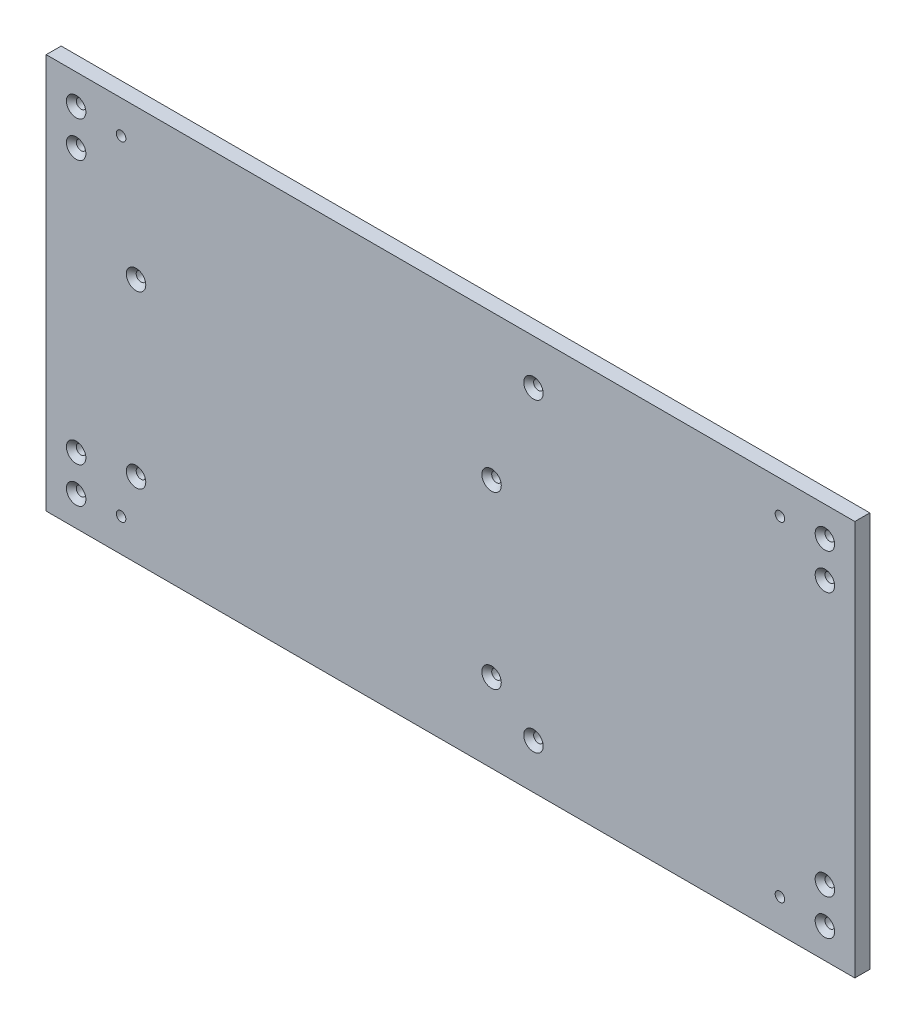
from build123d import *

# Parameters (mm, degrees)
SKETCH1_W                            = 270
SKETCH1_H                            = 132
SHEET_DEPTH                          = 2.5
F_3_2_3_2_WALLMOUNTHOLES_D           = 3.2
F_3_2_3_2_WALLMOUNTHOLES_CSINK_D     = 6.5
F_3_2_3_2_WALLMOUNTHOLES_CSINK_ANGLE = 90
F_3_2_3_2_FEETMOUNTHOLES_D           = 3.2
F_3_2_3_2_PSUHOLES_D                 = 3.2
F_3_2_3_2_PSUHOLES_CSINK_D           = 6.5
F_3_2_3_2_PSUHOLES_CSINK_ANGLE       = 90


with BuildPart() as part:
    # Sketch1 → Sheet (new, symmetric)
    with BuildSketch(Plane.XY):
        Rectangle(SKETCH1_W, SKETCH1_H)
    extrude(amount=SHEET_DEPTH, both=True)

    # Ø3.2 (3.2) WallMountHoles (through all)
    with Locations(Plane.XY.offset(2.5)):
        with Locations((-125, 56), (-125, 44), (-125, -44), (-125, -56), (125, -56), (125, -44), (125, 44), (125, 56), (27.7, -51), (27.7, 51)):
            CounterSinkHole(F_3_2_3_2_WALLMOUNTHOLES_D / 2, F_3_2_3_2_WALLMOUNTHOLES_CSINK_D / 2, counter_sink_angle=F_3_2_3_2_WALLMOUNTHOLES_CSINK_ANGLE)

    # Ø3.2 (3.2) FeetMountHoles (through all)
    with Locations(Plane.XY.offset(2.5)):
        with Locations((110, 55), (-110, 55), (-110, -55), (110, -55)):
            Hole(F_3_2_3_2_FEETMOUNTHOLES_D / 2)

    # Ø3.2 (3.2) PSUHoles (through all)
    with Locations(Plane.XY.offset(2.5)):
        with Locations((13.7, -39.65), (-105, 16), (13.7, 17.35), (-105, -41)):
            CounterSinkHole(F_3_2_3_2_PSUHOLES_D / 2, F_3_2_3_2_PSUHOLES_CSINK_D / 2, counter_sink_angle=F_3_2_3_2_PSUHOLES_CSINK_ANGLE)


solid = part.part
